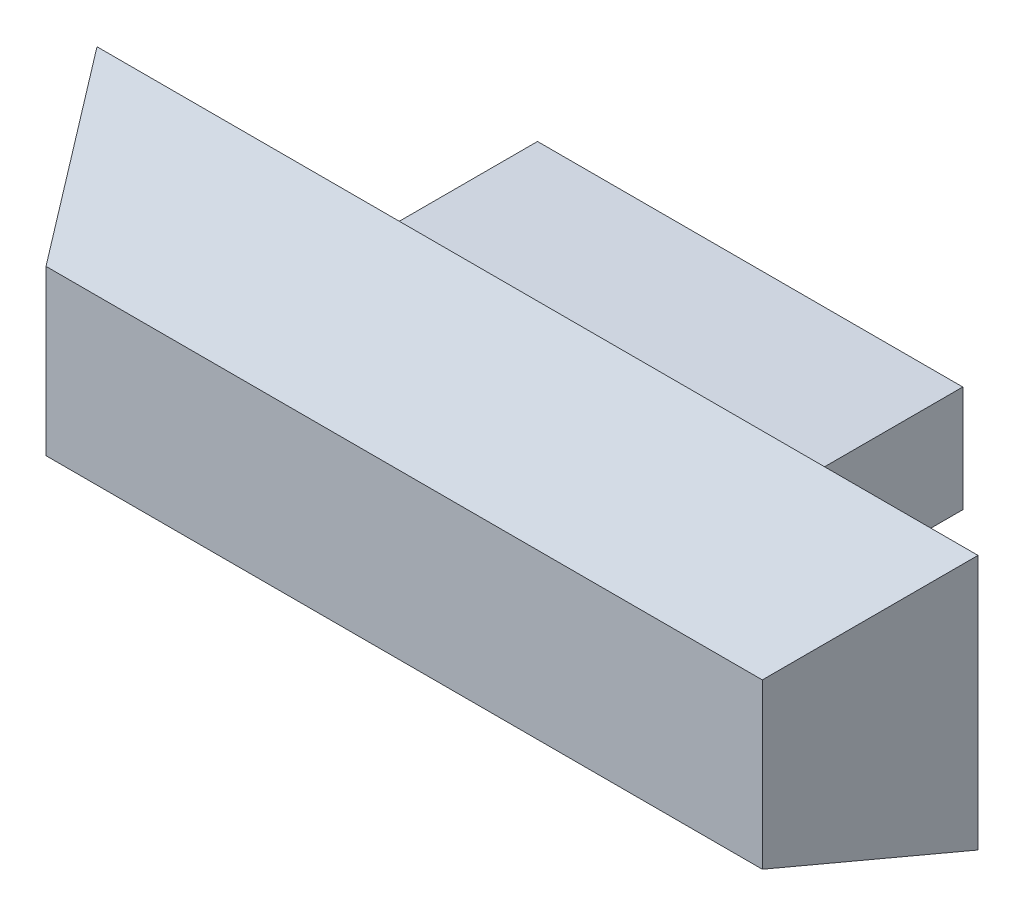
from build123d import *

# Parameters (mm, degrees)
SKETCH1_W           = 13.155170484
SKETCH1_H           = 3.81
BOSS_EXTRUDE1_DEPTH = 2.54
CHAMFER1_SIZE       = 2.54
CHAMFER1_SIZE_2     = 1.778527147
CHAMFER2_SIZE       = 0.680590949
CHAMFER2_SIZE_2     = 2.54
SKETCH2_W           = 6.35
SKETCH2_H           = 1.5875
BOSS_EXTRUDE3_DEPTH = 3.175


with BuildPart() as part:
    # Sketch1 → Boss-Extrude1 (new body)
    with BuildSketch(Plane.XY):
        with Locations((76.924914758, 65.532)):
            Rectangle(SKETCH1_W, SKETCH1_H)
    extrude(amount=BOSS_EXTRUDE1_DEPTH)

    # Chamfer1
    # the kernel refuses this chamfer: 2.54, 1.778527147 mm, written as the material it takes off along each edge
    with BuildSketch(Plane(origin=(70.347329516, 73.996682665, 2.54), x_dir=(-0.02220967419845826, 0, -0.9997533347641299), z_dir=(0, -1, 0))) as chamfer1_piece_1:
        Polygon((CHAMFER1_SIZE * 0.999753334764, CHAMFER1_SIZE * 0.0222096741985), (-CHAMFER1_SIZE_2 * 0.0222096741991, CHAMFER1_SIZE_2 * 0.999753334794), (0, 0), align=None)
    extrude(amount=16.92936533, mode=Mode.SUBTRACT)

    # Chamfer2
    # the kernel refuses this chamfer: 2.54, 0.680590949 mm, written as the material it takes off along each edge
    with BuildSketch(Plane(origin=(65.530183875, 63.627, 2.54), x_dir=(0, 0.9905000388259545, 0.13751244702128823), z_dir=(1, 0, 0))) as chamfer2_piece_1:
        Polygon((CHAMFER2_SIZE * 0.990500038499, -CHAMFER2_SIZE * 0.137512446976), (-CHAMFER2_SIZE_2 * 0.137512447021, -CHAMFER2_SIZE_2 * 0.990500038826), (0, 0), align=None)
    extrude(amount=24.567988913, mode=Mode.SUBTRACT)
    with BuildSketch(Plane(origin=(83.5025, 57.031327212, 2.54), x_dir=(-0.9905000388259543, 0, 0.13751244702128956), z_dir=(0, 1, 0))) as chamfer2_piece_2:
        Polygon((CHAMFER2_SIZE * 0.990500038499, -CHAMFER2_SIZE * 0.137512446976), (-CHAMFER2_SIZE_2 * 0.137512447021, -CHAMFER2_SIZE_2 * 0.990500038826), (0, 0), align=None)
    extrude(amount=17.001345577, mode=Mode.SUBTRACT)
    with BuildSketch(Plane(origin=(90.098172788, 67.437, 2.54), x_dir=(0, 0.009967146577158238, -0.9999503267608394), z_dir=(-1, 0, 0))) as chamfer2_piece_3:
        Polygon((CHAMFER2_SIZE_2 * 0.999950326761, CHAMFER2_SIZE_2 * 0.00996714657716), (-CHAMFER2_SIZE * 0.00996714657386, CHAMFER2_SIZE * 0.99995032643), (0, 0), align=None)
    extrude(amount=24.567988913, mode=Mode.SUBTRACT)

    # Sketch2 → Boss-Extrude3 (add)
    with BuildSketch(Plane(origin=(0, 0, 0), x_dir=(-1, 0, 0), z_dir=(0, 0, -1))):
        with Locations((-76.924914758, 65.532)):
            Rectangle(SKETCH2_W, SKETCH2_H)
    extrude(amount=BOSS_EXTRUDE3_DEPTH)


solid = part.part
